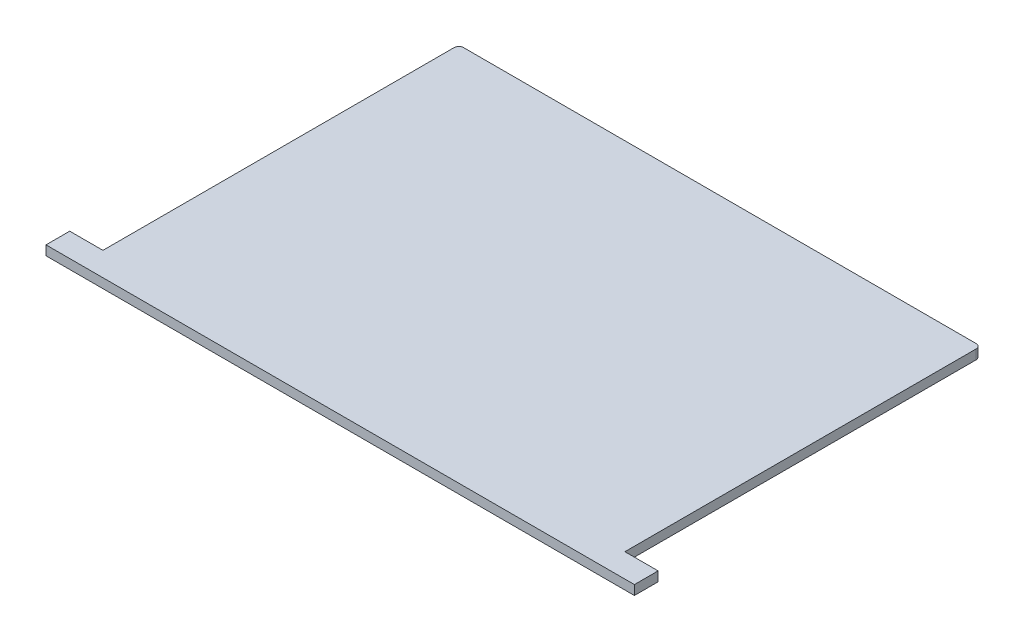
from build123d import *

# Parameters (mm, degrees)
BOSS_EXTRUDE1_DEPTH = 1
FILLET1_R           = 0.5


with BuildPart() as part:
    # Sketch1 → Boss-Extrude1 (new body)
    with BuildSketch(Plane(origin=(0, 0, 0), x_dir=(1, 0, 0), z_dir=(0, 1, 0))):
        Polygon((-27.5, -20), (27.5, -20), (31, -20), (31, -17.5), (27.5, -17.5), (27.5, 20), (-27.5, 20), (-27.5, -17.5), (-31, -17.5), (-31, -20), align=None)
    extrude(amount=BOSS_EXTRUDE1_DEPTH)

    # Fillet1
    fillet1_edges = [part.edges().sort_by_distance(p)[0] for p in [
        (27.5, 0.5, -20),
        (-27.5, 0.5, -20),
    ]]
    fillet(fillet1_edges, radius=FILLET1_R)


solid = part.part
